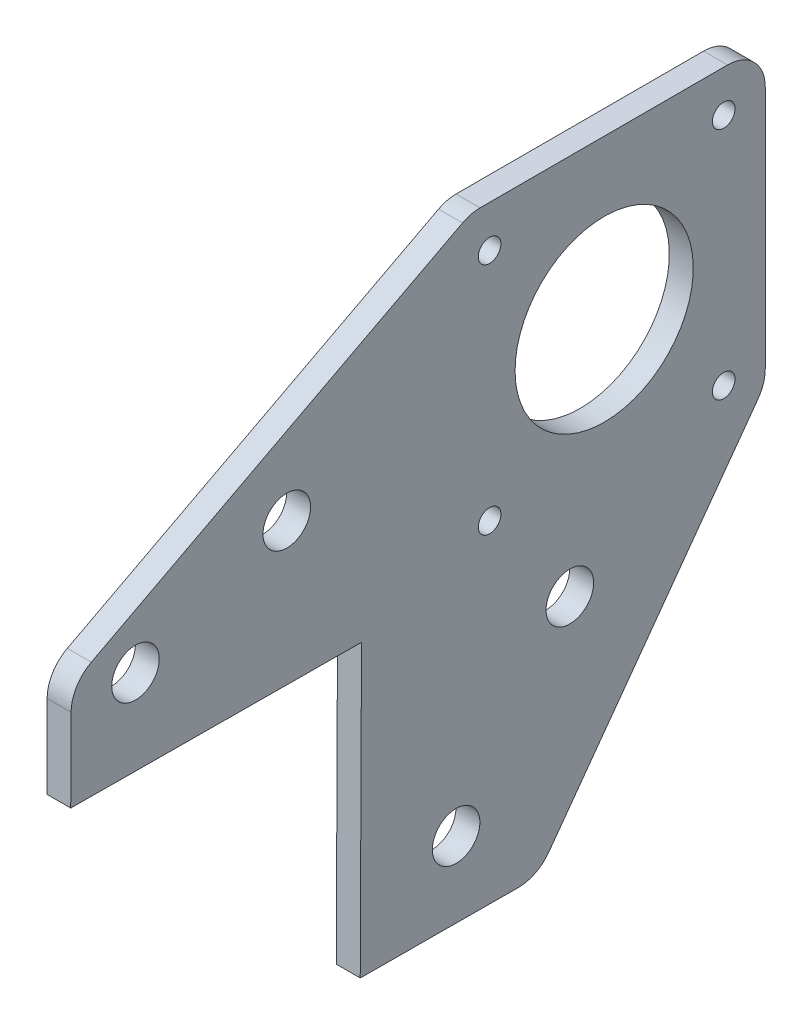
from build123d import *

# Parameters (mm, degrees)
SKETCH1_R          = 1.5
SKETCH1_RX         = 1.5
SKETCH1_RY         = 1.499999958
BASE_FLANGE1_DEPTH = 3.175
SKETCH2_R          = 3.15
CUT_EXTRUDE1_DEPTH = 10


# Sheet-metal steps are written as plain solids
with BuildPart() as part:
    # Sketch1 → Base-Flange1 (new body)
    with BuildSketch(Plane(origin=(0, 0, 0), x_dir=(0, 0, -1), z_dir=(1, 0, 0))):
        with BuildLine():
            Line((15.865201272, 80.394978876), (48.626542571, 80.394978876))
            ThreePointArc((48.626542571, 80.394978876), (52.162076477, 78.930512782), (53.626542571, 75.394978876))
            Line((53.626542571, 75.394978876), (53.626542571, 43.023123453))
            ThreePointArc((53.626542571, 43.023123453), (53.381665801, 41.477548132), (52.671021343, 40.083363009))
            Line((52.671021343, 40.083363009), (24.97388681, 1.978056535))
            ThreePointArc((24.97388681, 1.978056535), (23.188445465, 0.457239672), (20.905954013, -0.082128012))
            Line((20.905954013, -0.082128012), (6.9504e-05, 0.015938493))
            Line((6.9504e-05, 0.015938493), (0.167574588, 38.427897973))
            Line((0.167574588, 38.427897973), (-38.331753926, 38.667513874))
            Line((-38.331753926, 38.667513874), (-38.283953708, 49.628972315))
            ThreePointArc((-38.283953708, 49.628972315), (-37.557098456, 52.203443057), (-35.60707457, 54.034733587))
            Line((-35.60707457, 54.034733587), (13.54212795, 79.822543708))
            ThreePointArc((13.54212795, 79.822543708), (14.668920402, 80.249761269), (15.865201272, 80.394978876))
        make_face()
        with Locations((17.130255889, 43.891226665)):
            Circle(SKETCH1_R, mode=Mode.SUBTRACT)
        with Locations(Location((48.129224581, 43.894326732), (0, 0, 119.309738267))):
            Ellipse(SKETCH1_RX, SKETCH1_RY, mode=Mode.SUBTRACT)
        with Locations(Location((17.126576602, 74.891226239), (0, 0, 119.309738267))):
            Ellipse(SKETCH1_RX, SKETCH1_RY, mode=Mode.SUBTRACT)
        with Locations(Location((48.126575725, 74.894904787), (0, 0, 119.309738267))):
            Ellipse(SKETCH1_RX, SKETCH1_RY, mode=Mode.SUBTRACT)
        with BuildLine():
            add(Edge.make_bspline(
                [(32.302616578, 47.592077565), (33.84702501, 47.592261157), (36.935768822, 48.207032249), (40.863315512, 50.83201062), (43.487359793, 54.760181559), (44.408414716, 59.393516648), (43.486258021, 64.026632625), (40.861279703, 67.954179586), (36.93310891, 70.578224108), (32.299774036, 71.499279195), (27.666658318, 70.577122557), (23.739111629, 67.952144186), (21.115067347, 64.023973247), (20.194012424, 59.390638157), (21.116169119, 54.75752218), (23.741147438, 50.82997522), (27.669318231, 48.205930698), (30.758208146, 47.591893973), (32.302616578, 47.592077565)],
                knots=[0, 0, 0, 0, 0.392699082, 0.785398163, 1.178097245, 1.570796327, 1.963495408, 2.35619449, 2.748893572, 3.141592654, 3.534291735, 3.926990817, 4.319689899, 4.71238898, 5.105088062, 5.497787144, 5.890486225, 6.283185307, 6.283185307, 6.283185307, 6.283185307], degree=3))
        make_face(mode=Mode.SUBTRACT)
    extrude(amount=-BASE_FLANGE1_DEPTH)

    # Sketch2 → Cut-Extrude1 (cut)
    with BuildSketch(Plane(origin=(-3.175, -854.244613751, -1311.587435239), x_dir=(0, 0, 1), z_dir=(-1, 0, 0))):
        with Locations((1283.833112159, 884.130691082)):
            Circle(SKETCH2_R)
        with Locations((1298.892990926, 864.201114773)):
            Circle(SKETCH2_R)
        with Locations((1341.343837435, 904.15787978)):
            Circle(SKETCH2_R)
        with Locations((1321.311357388, 911.570594384)):
            Circle(SKETCH2_R)
    extrude(amount=-CUT_EXTRUDE1_DEPTH, mode=Mode.SUBTRACT)


solid = part.part
